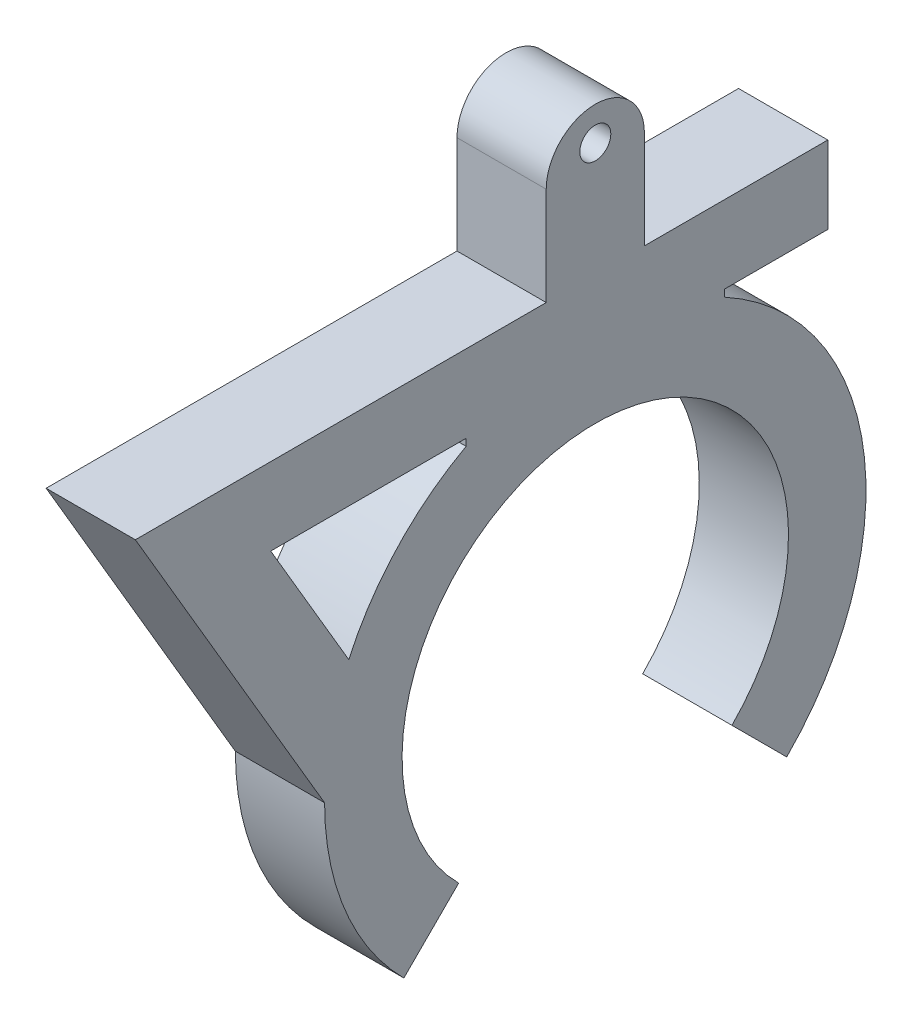
from build123d import *

# Parameters (mm, degrees)
SKETCH1_R           = 0.3
BOSS_EXTRUDE1_DEPTH = 1.7272


with BuildPart() as part:
    # Sketch1 → Boss-Extrude1 (new body)
    with BuildSketch(Plane(origin=(0, 0, 0), x_dir=(0, 0, -1), z_dir=(1, 0, 0))):
        with BuildLine():
            Line((-3.705239533, -3.705239533), (-2.644579362, -2.644579362))
            ThreePointArc((-2.644579362, -2.644579362), (0, 3.74), (2.644579362, -2.644579362))
            Line((2.644579362, -2.644579362), (3.705239533, -3.705239533))
            ThreePointArc((3.705239533, -3.705239533), (5.185747801, 0.752076956), (2.5, 4.605171007))
            Line((2.5, 4.605171007), (2.5, 4.74))
            Line((2.5, 4.74), (4.5, 4.74))
            Line((4.5, 4.74), (4.5, 6.24))
            Line((4.5, 6.24), (0.95, 6.24))
            Line((0.95, 6.24), (0.95, 8.14))
            ThreePointArc((0.95, 8.14), (0, 9.09), (-0.95, 8.14))
            Line((-0.95, 8.14), (-0.95, 6.24))
            Line((-0.95, 6.24), (-8.902675453, 6.24))
            Line((-8.902675453, 6.24), (-5.24, 0))
            ThreePointArc((-5.24, 0), (-4.84112875, -2.005261186), (-3.705239533, -3.705239533))
        make_face()
        with BuildLine():
            ThreePointArc((-2.5, 4.605171007), (-3.835037239, 3.570726729), (-4.771676297, 2.165341847))
            Line((-4.771676297, 2.165341847), (-6.282916236, 4.74))
            Line((-6.282916236, 4.74), (-2.5, 4.74))
            Line((-2.5, 4.74), (-2.5, 4.605171007))
        make_face(mode=Mode.SUBTRACT)
        with Locations((0, 8.44)):
            Circle(SKETCH1_R, mode=Mode.SUBTRACT)
    extrude(amount=BOSS_EXTRUDE1_DEPTH)


solid = part.part
